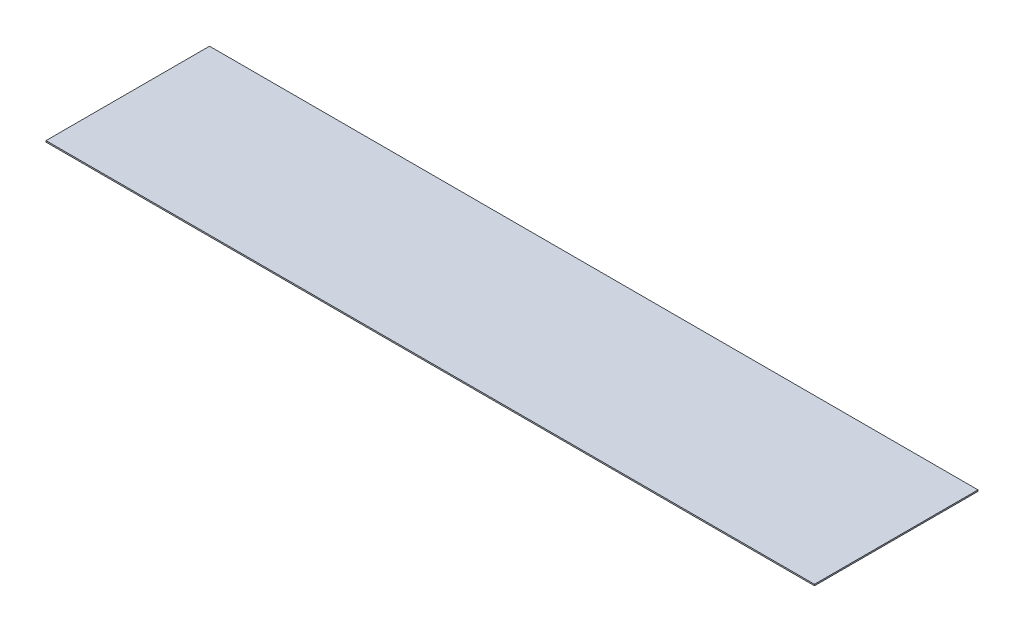
from build123d import *

# Parameters (mm, degrees)
SKETCH3_W           = 13106.4
SKETCH3_H           = 1828.8
BOSS_EXTRUDE3_DEPTH = 304.8
SKETCH4_W           = 14325.6
SKETCH4_H           = 3048
BOSS_EXTRUDE4_DEPTH = 25.4


with BuildPart() as part:
    # Sketch3 → Boss-Extrude3 (new body)
    with BuildSketch(Plane(origin=(0, 0, 0), x_dir=(-1, 0, 0), z_dir=(0, 1, 0))):
        Rectangle(SKETCH3_W, SKETCH3_H)
    extrude(amount=BOSS_EXTRUDE3_DEPTH)


with BuildPart() as body_2:
    # Sketch4 → Boss-Extrude4 (new body)
    with BuildSketch(Plane(origin=(0, 304.8, 0), x_dir=(1, 0, 0), z_dir=(0, 1, 0))):
        Rectangle(SKETCH4_W, SKETCH4_H)
    extrude(amount=BOSS_EXTRUDE4_DEPTH)


solid = Compound([part.part, body_2.part])
